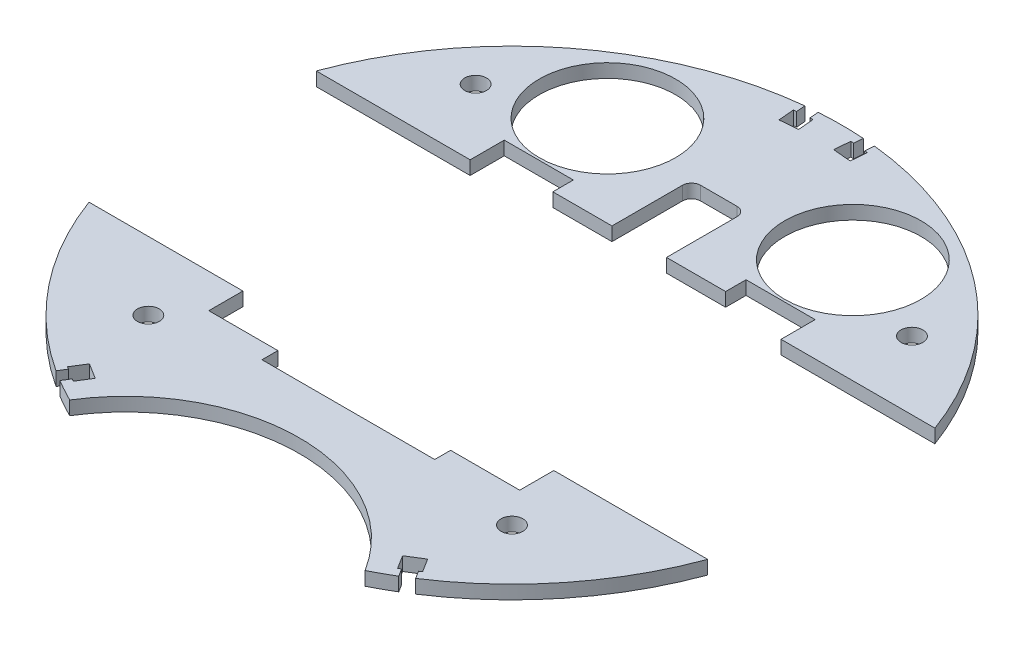
from build123d import *

# Parameters (mm, degrees)
BOSS_EXTRUDE1_DEPTH  = 3
SOLENOID_PLACEMENT_W = 38
SOLENOID_PLACEMENT_H = 64
CUT_EXTRUDE1_DEPTH   = 103.574363269
SKETCH7_R            = 15
CUT_EXTRUDE6_DEPTH   = 103.574363269
SKETCH8_R            = 2.4
CUT_EXTRUDE7_DEPTH   = 103.574363269
CUT_EXTRUDE3_DEPTH   = 103.574363269
CUT_EXTRUDE8_DEPTH   = 100.481153994
CUT_EXTRUDE9_DEPTH   = 100.481153994


with BuildPart() as part:
    # Sketch1 → Boss-Extrude1 (new body)
    with BuildSketch(Plane(origin=(0, 0, 0), x_dir=(1, 0, 0), z_dir=(0, 1, 0))):
        with BuildLine():
            ThreePointArc((32.48910875, -64.812867647), (0, 72.5), (-32.48910875, -64.812867647))
            ThreePointArc((-32.48910875, -64.812867647), (0, -46.75), (32.48910875, -64.812867647))
        make_face()
    extrude(amount=BOSS_EXTRUDE1_DEPTH)

    # solenoid placement → Cut-Extrude1 (cut, through all)
    with BuildSketch(Plane(origin=(0, 3, 0), x_dir=(1, 0, 0), z_dir=(0, 1, 0))):
        with Locations((0, -4)):
            Rectangle(SOLENOID_PLACEMENT_W, SOLENOID_PLACEMENT_H)
    extrude(amount=-CUT_EXTRUDE1_DEPTH, mode=Mode.SUBTRACT)

    # Sketch7 → Cut-Extrude6 (cut, through all)
    with BuildSketch(Plane(origin=(0, 3, 0), x_dir=(1, 0, 0), z_dir=(0, 1, 0))):
        with Locations((27, 48)):
            Circle(SKETCH7_R)
        with Locations((-27, 48)):
            Circle(SKETCH7_R)
    extrude(amount=-CUT_EXTRUDE6_DEPTH, mode=Mode.SUBTRACT)

    # Sketch8 → Cut-Extrude7 (cut, through all)
    with BuildSketch(Plane(origin=(0, 3, 0), x_dir=(1, 0, 0), z_dir=(0, 1, 0))):
        with Locations((40, -40)):
            Circle(SKETCH8_R)
        with Locations((-40, -40)):
            Circle(SKETCH8_R)
        with Locations((48, 40)):
            Circle(SKETCH8_R)
        with Locations((-48, 40)):
            Circle(SKETCH8_R)
    extrude(amount=-CUT_EXTRUDE7_DEPTH, mode=Mode.SUBTRACT)

    # Sketch3 → Cut-Extrude3 (cut, through all)
    with BuildSketch(Plane(origin=(0, 3, 0), x_dir=(1, 0, 0), z_dir=(0, 1, 0))):
        with BuildLine():
            Line((-34.2, -32.5), (-22.2, -32.5))
            Line((-22.2, -32.5), (-19, -32.5))
            Line((-19, -32.5), (-19, 32.5))
            Line((-19, 32.5), (-22.2, 32.5))
            Line((-22.2, 32.5), (-34.2, 32.5))
            Line((-34.2, 32.5), (-34.2, 25))
            Line((-34.2, 25), (-68.053287944, 25))
            ThreePointArc((-68.053287944, 25), (-72.5, 0), (-68.053287944, -25))
            Line((-68.053287944, -25), (-34.2, -25))
            Line((-34.2, -25), (-34.2, -32.5))
        make_face()
        with BuildLine():
            Line((19, 32.5), (19, -32.5))
            Line((19, -32.5), (22.2, -32.5))
            Line((22.2, -32.5), (34.2, -32.5))
            Line((34.2, -32.5), (34.2, -25))
            Line((34.2, -25), (68.053287944, -25))
            ThreePointArc((68.053287944, -25), (72.5, 0), (68.053287944, 25))
            Line((68.053287944, 25), (34.2, 25))
            Line((34.2, 25), (34.2, 32.5))
            Line((34.2, 32.5), (22.2, 32.5))
            Line((22.2, 32.5), (19, 32.5))
        make_face()
    extrude(amount=-CUT_EXTRUDE3_DEPTH, mode=Mode.SUBTRACT)


with BuildPart() as cut_extrude3_piece_1:
    # of the separate pieces the step leaves, piece 1, a body of its own (cut_extrude3_pieces)
    add(part.part.solids().sort_by_distance((68.053287944, 0, -25))[0])

    # Sketch9 → Cut-Extrude8 (cut, through all)
    with BuildSketch(Plane(origin=(0, 3, 0), x_dir=(1, 0, 0), z_dir=(0, 1, 0))):
        with BuildLine():
            Line((6, 43.5), (6, 28))
            Line((6, 28), (-6, 28))
            Line((-6, 28), (-6, 43.5))
            ThreePointArc((-6, 43.5), (-5.414213562, 44.914213562), (-4, 45.5))
            Line((-4, 45.5), (4, 45.5))
            ThreePointArc((4, 45.5), (5.414213562, 44.914213562), (6, 43.5))
        make_face()
    extrude(amount=-CUT_EXTRUDE8_DEPTH, mode=Mode.SUBTRACT)


with BuildPart() as cut_extrude3_piece_2:
    # of the separate pieces the step leaves, piece 2, a body of its own (cut_extrude3_pieces)
    add(part.part.solids().sort_by_distance((32.48910875, 0, 64.812867647))[0])


with BuildPart() as cut_extrude9_tool:
    # Sketch10 → Cut-Extrude9 (new, through all)
    with BuildSketch(Plane(origin=(0, 3, 0), x_dir=(1, 0, 0), z_dir=(0, 1, 0))):
        Polygon((3.847045368, 66.919356258), (7.83182416, 66.570733287), (8.13686926, 70.05741473), (7.489342706, 70.114065963), (7.663654192, 72.106455359), (4.973928507, 72.341775864), (4.799617021, 70.349386468), (4.152090468, 70.406037701), align=None)
        Polygon((-7.489342706, 70.114065963), (-8.13686926, 70.05741473), (-7.83182416, 66.570733287), (-3.847045368, 66.919356258), (-4.152090468, 70.406037701), (-4.799617021, 70.349386468), (-4.973928507, 72.341775864), (-7.663654192, 72.106455359), align=None)
        Polygon((37.200686896, -55.759383914), (33.808494511, -57.879060971), (35.663211936, -60.847229307), (36.214443199, -60.502781786), (37.274281727, -62.198877978), (39.564011587, -60.768095965), (38.504173058, -59.071999772), (39.055404321, -58.727552251), align=None)
        Polygon((-33.808494511, -57.879060971), (-37.200686896, -55.759383914), (-39.055404321, -58.727552251), (-38.504173058, -59.071999772), (-39.564011587, -60.768095965), (-37.274281727, -62.198877978), (-36.214443199, -60.502781786), (-35.663211936, -60.847229307), align=None)
    extrude(amount=-CUT_EXTRUDE9_DEPTH)


with BuildPart() as cut_extrude3_piece_1_1:
    add(cut_extrude3_piece_1.part)

    # Cut-Extrude9: cut by cut_extrude9_tool
    add(cut_extrude9_tool.part, mode=Mode.SUBTRACT)


with BuildPart() as cut_extrude3_piece_2_1:
    add(cut_extrude3_piece_2.part)

    # Cut-Extrude9: cut by cut_extrude9_tool
    add(cut_extrude9_tool.part, mode=Mode.SUBTRACT)


solid = Compound([cut_extrude3_piece_1_1.part, cut_extrude3_piece_2_1.part])
